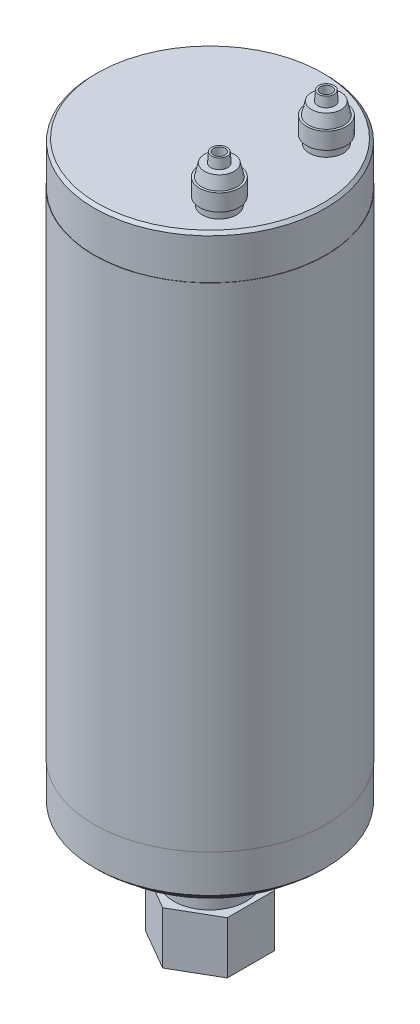
from build123d import *

# Parameters (mm, degrees)
SKETCH2_R           = 12.5
BOSS_EXTRUDE1_DEPTH = 12.72
CHAMFER1_SIZE       = 1
BOSS_EXTRUDE2_DEPTH = 18


with BuildPart() as part:
    # Sketch1 → Revolve1 (revolve)
    with BuildSketch(Plane(origin=(0, 0, 0), x_dir=(0, 0, -1), z_dir=(1, 0, 0))):
        Polygon((0, 104.5), (0, -104.5), (-19.925, -104.5), (-21.965, -98.5), (-35, -98.5), (-35, -94.5), (-39.9, -94.5), (-39.9, -80.5), (-40, -80.5), (-40, 89.5), (-39.9, 89.5), (-39.9, 104.5), align=None)
    revolve(axis=Axis((0, 104.5, 0), (0, -1, 0)))

    # Sketch2 → Boss-Extrude1 (add)
    with BuildSketch(Plane.XZ.offset(104.5)):
        Circle(SKETCH2_R)
    extrude(amount=BOSS_EXTRUDE1_DEPTH)

    # Chamfer1
    chamfer1_edges = [part.edges().sort_by_distance(p)[0] for p in [
        (0, 104.5, -39.9),
        (0, -94.5, -39.9),
        (0, -98.5, -35),
    ]]
    chamfer(chamfer1_edges, length=CHAMFER1_SIZE)

    # Sketch3 → Boss-Extrude2 (add)
    with BuildSketch(Plane.XZ.offset(117.22)):
        Polygon((0, 16.310145105), (-14.125, 8.155072552), (-14.125, -8.155072552), (0, -16.310145105), (14.125, -8.155072552), (14.125, 8.155072552), align=None)
    extrude(amount=BOSS_EXTRUDE2_DEPTH)

    # Sketch4 → Revolve2 (revolve)
    with BuildSketch(Plane(origin=(0, 0, 0), x_dir=(0, 0, -1), z_dir=(1, 0, 0))):
        Polygon((-6, -135.22), (-6, -139.22), (-8, -139.22), (-12, -135.22), align=None)
    revolve(axis=Axis((0, 258.155027854, 0), (0, -1, 0)))

    # Sketch6 → Revolve3 (revolve)
    with BuildSketch(Plane(origin=(21.67, 0, 0), x_dir=(0, 0, -1), z_dir=(1, 0, 0))):
        Polygon((20.45, 104.5), (24.3, 104.5), (24.3, 107.26), (25.275, 107.26), (25.275, 113.02), (24.54, 113.02), (23.56, 117.19), (21.355, 117.19), (21.11, 120.5), (20.45, 120.5), align=None)
    revolve3 = revolve(axis=Axis((21.67, 104.5, -18.45), (0, 1, 0)))

    # Mirror1: Revolve3 across plane
    add(revolve3.mirror(Plane.XY))


solid = part.part
